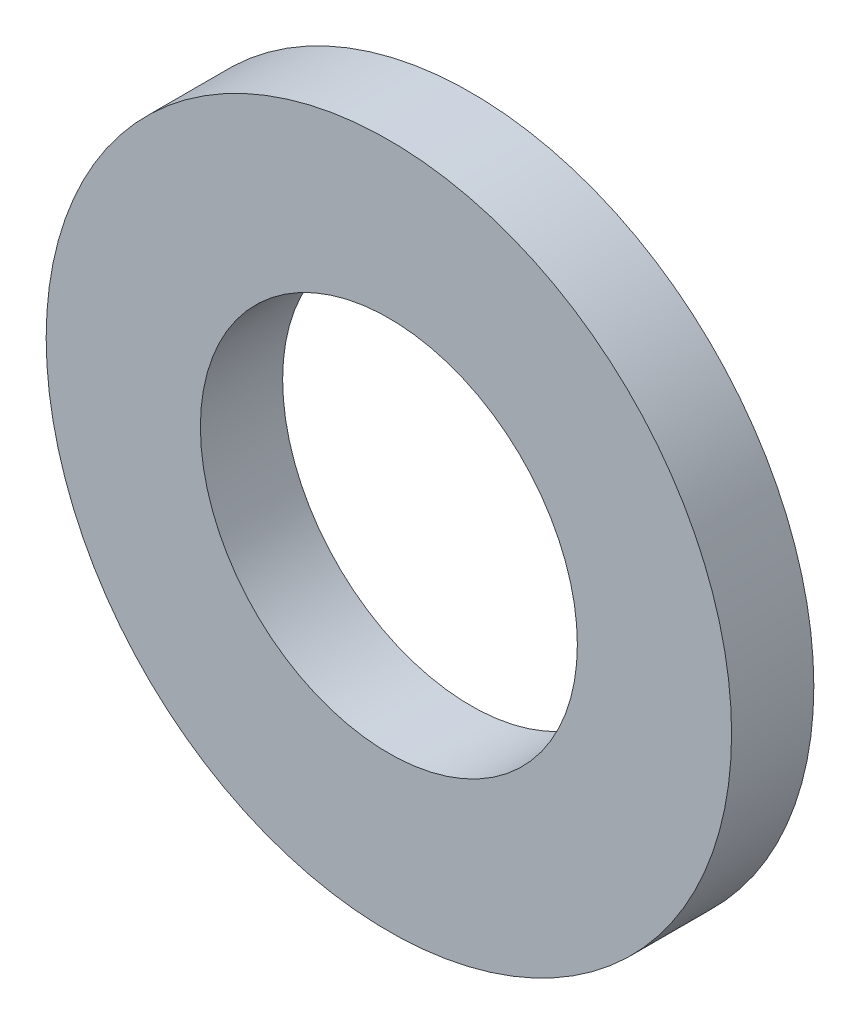
from build123d import *

# Parameters (mm, degrees)
SKETCH1_R           = 5
SKETCH1_R_2         = 2.75
BOSS_EXTRUDE1_DEPTH = 1.2


with BuildPart() as part:
    # Sketch1 → Boss-Extrude1 (new body)
    with BuildSketch(Plane.XY):
        Circle(SKETCH1_R)
        Circle(SKETCH1_R_2, mode=Mode.SUBTRACT)
    extrude(amount=BOSS_EXTRUDE1_DEPTH)


solid = part.part
